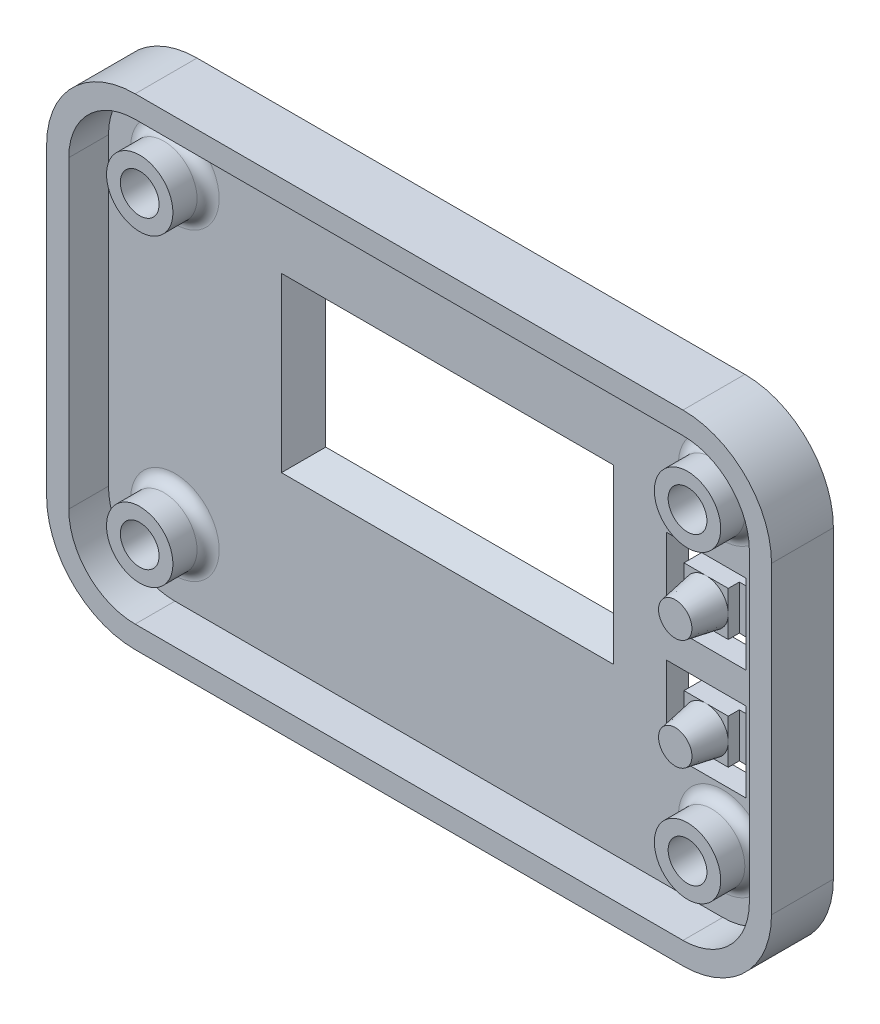
from build123d import *

# Parameters (mm, degrees)
BOSS_EXTRUDE1_DEPTH       = 3.59
SHELL1_T                  = 2
CUT_EXTRUDE2_START        = -3.59
SKETCH6_W                 = 26
SKETCH6_H                 = 11.6
CUT_EXTRUDE2_DEPTH        = 417.990251938
CUT_EXTRUDE3_REACH        = 422.58
SKETCH4_R                 = 1.75
BOSS_EXTRUDE2_START       = -0.8
SKETCH4_3_R               = 3
SKETCH4_3_R_2             = 1.75
BOSS_EXTRUDE2_DEPTH       = 4.79
BOSS_EXTRUDE3_START       = -0.41148
SKETCH4_4_R               = 3
SKETCH4_4_R_2             = 1.75
BOSS_EXTRUDE3_DEPTH       = 5.17852
CHAMFER1_SIZE             = 2
CUT_EXTRUDE4_START        = -5.59
CUT_EXTRUDE4_DEPTH        = 2
BOSS_EXTRUDE4_START       = -5.59
BOSS_EXTRUDE4_DEPTH       = 1
BOSS_EXTRUDE5_OUTLINE_R   = 1.508047724
BOSS_EXTRUDE5_DEPTH       = 2.79
BOSS_EXTRUDE5_DRAFT       = 10
BOSS_EXTRUDE5_2_OUTLINE_R = 1.508047724
BOSS_EXTRUDE5_2_DEPTH     = 2.79
BOSS_EXTRUDE5_2_DRAFT     = 10
CUT_EXTRUDE7_START        = -5.59
SKETCH4_5_R               = 3
CUT_EXTRUDE7_DEPTH        = 1.5
FILLET2_R                 = 1


# Read off the part's stored shape, not the designer's step: Boss-Extrude5
with BuildPart() as part:
    # Sketch3 → Boss-Extrude1 (new body)
    # profile 1 of 2: a face of its own
    with BuildSketch(Plane.XY):
        with BuildLine():
            Line((409.499839162, 48.499999974), (360.000160838, 48.499999974))
            ThreePointArc((360.000160838, 48.499999974), (355.756888215, 46.743111785), (354.000000026, 42.499839162))
            Line((354.000000026, 42.499839162), (354.000000026, 15.000161001))
            ThreePointArc((354.000000026, 15.000161001), (355.756887739, 10.756887739), (360.000161001, 9.000000026))
            Line((360.000161001, 9.000000026), (409.499838999, 9.000000026))
            ThreePointArc((409.499838999, 9.000000026), (413.743112261, 10.756887739), (415.499999974, 15.000161001))
            Line((415.499999974, 15.000161001), (415.499999974, 42.499839162))
            ThreePointArc((415.499999974, 42.499839162), (413.743111785, 46.743111785), (409.499839162, 48.499999974))
        make_face()
        with BuildLine():
            ThreePointArc((360, 47.5), (356.46399498, 46.03600502), (355, 42.5))
            Line((355, 42.5), (355, 15))
            ThreePointArc((355, 15), (356.463994503, 11.463994503), (360, 10))
            Line((360, 10), (409.5, 10))
            ThreePointArc((409.5, 10), (413.036005497, 11.463994503), (414.5, 15))
            Line((414.5, 15), (414.5, 42.5))
            ThreePointArc((414.5, 42.5), (413.03600502, 46.03600502), (409.5, 47.5))
            Line((409.5, 47.5), (360, 47.5))
        make_face(mode=Mode.SUBTRACT)
    # profile 2 of 2: a face of its own
    with BuildSketch(Plane.XY):
        with BuildLine():
            Line((409.5, 47.5), (360, 47.5))
            ThreePointArc((360, 47.5), (356.46399498, 46.03600502), (355, 42.5))
            Line((355, 42.5), (355, 15))
            ThreePointArc((355, 15), (356.463994503, 11.463994503), (360, 10))
            Line((360, 10), (409.5, 10))
            ThreePointArc((409.5, 10), (413.036005497, 11.463994503), (414.5, 15))
            Line((414.5, 15), (414.5, 42.5))
            ThreePointArc((414.5, 42.5), (413.03600502, 46.03600502), (409.5, 47.5))
        make_face()
    extrude(amount=-BOSS_EXTRUDE1_DEPTH)

    # Shell1
    shell1_openings = [part.faces().sort_by_distance(p)[0] for p in [
        (384.75, 28.749999938, 0),
    ]]
    offset(amount=SHELL1_T, openings=shell1_openings, kind=Kind.INTERSECTION)

    # Sketch6 → Cut-Extrude2 (cut, through all)
    with BuildSketch(Plane.XY.offset(CUT_EXTRUDE2_START)):
        with Locations((384.62991333, 31.670090703)):
            Rectangle(SKETCH6_W, SKETCH6_H)
    extrude(amount=-CUT_EXTRUDE2_DEPTH, mode=Mode.SUBTRACT)

    # Sketch4 → Cut-Extrude3 (cut, up to next)
    with BuildSketch(Plane.XY, mode=Mode.PRIVATE) as cut_extrude3_sk1:
        with Locations((409.49999888, 42.49999882)):
            Circle(SKETCH4_R)
    cut_extrude3_tool1 = extrude(cut_extrude3_sk1.sketch, amount=-CUT_EXTRUDE3_REACH, mode=Mode.PRIVATE) & part.part
    # Sketch4 → Cut-Extrude3 (cut, up to next)
    with BuildSketch(Plane.XY, mode=Mode.PRIVATE) as cut_extrude3_sk2:
        with Locations((359.99999888, 42.49999882)):
            Circle(SKETCH4_R)
    cut_extrude3_tool2 = extrude(cut_extrude3_sk2.sketch, amount=-CUT_EXTRUDE3_REACH, mode=Mode.PRIVATE) & part.part
    # Sketch4 → Cut-Extrude3 (cut, up to next)
    with BuildSketch(Plane.XY, mode=Mode.PRIVATE) as cut_extrude3_sk3:
        with Locations((359.99999888, 14.99999882)):
            Circle(SKETCH4_R)
    cut_extrude3_tool3 = extrude(cut_extrude3_sk3.sketch, amount=-CUT_EXTRUDE3_REACH, mode=Mode.PRIVATE) & part.part
    # Sketch4 → Cut-Extrude3 (cut, up to next)
    with BuildSketch(Plane.XY, mode=Mode.PRIVATE) as cut_extrude3_sk4:
        with Locations((409.49999888, 14.99999882)):
            Circle(SKETCH4_R)
    cut_extrude3_tool4 = extrude(cut_extrude3_sk4.sketch, amount=-CUT_EXTRUDE3_REACH, mode=Mode.PRIVATE) & part.part
    add(cut_extrude3_tool1.solids().sort_by_distance((409.499999, 42.499999, 0))[0], mode=Mode.SUBTRACT)
    add(cut_extrude3_tool2.solids().sort_by_distance((359.999999, 42.499999, 0))[0], mode=Mode.SUBTRACT)
    add(cut_extrude3_tool3.solids().sort_by_distance((359.999999, 14.999999, 0))[0], mode=Mode.SUBTRACT)
    add(cut_extrude3_tool4.solids().sort_by_distance((409.499999, 14.999999, 0))[0], mode=Mode.SUBTRACT)

    # Sketch4<3> → Boss-Extrude2 (add)
    # profile 1 of 4: a face of its own
    with BuildSketch(Plane.XY.offset(BOSS_EXTRUDE2_START)):
        with Locations((409.49999888, 42.49999882)):
            Circle(SKETCH4_3_R)
        with Locations((409.49999888, 42.49999882)):
            Circle(SKETCH4_3_R_2, mode=Mode.SUBTRACT)
    # profile 2 of 4: a face of its own
    with BuildSketch(Plane.XY.offset(BOSS_EXTRUDE2_START)):
        with Locations((359.99999888, 42.49999882)):
            Circle(SKETCH4_3_R)
        with Locations((359.99999888, 42.49999882)):
            Circle(SKETCH4_3_R_2, mode=Mode.SUBTRACT)
    # profile 3 of 4: a face of its own
    with BuildSketch(Plane.XY.offset(BOSS_EXTRUDE2_START)):
        with Locations((359.99999888, 14.99999882)):
            Circle(SKETCH4_3_R)
        with Locations((359.99999888, 14.99999882)):
            Circle(SKETCH4_3_R_2, mode=Mode.SUBTRACT)
    # profile 4 of 4: a face of its own
    with BuildSketch(Plane.XY.offset(BOSS_EXTRUDE2_START)):
        with Locations((409.49999888, 14.99999882)):
            Circle(SKETCH4_3_R)
        with Locations((409.49999888, 14.99999882)):
            Circle(SKETCH4_3_R_2, mode=Mode.SUBTRACT)
    extrude(amount=-BOSS_EXTRUDE2_DEPTH)

    # Sketch4<4> → Boss-Extrude3 (add)
    # profile 1 of 4: a face of its own
    with BuildSketch(Plane.XY.offset(BOSS_EXTRUDE3_START)):
        with Locations((409.49999888, 42.49999882)):
            Circle(SKETCH4_4_R)
        with Locations((409.49999888, 42.49999882)):
            Circle(SKETCH4_4_R_2, mode=Mode.SUBTRACT)
    # profile 2 of 4: a face of its own
    with BuildSketch(Plane.XY.offset(BOSS_EXTRUDE3_START)):
        with Locations((359.99999888, 42.49999882)):
            Circle(SKETCH4_4_R)
        with Locations((359.99999888, 42.49999882)):
            Circle(SKETCH4_4_R_2, mode=Mode.SUBTRACT)
    # profile 3 of 4: a face of its own
    with BuildSketch(Plane.XY.offset(BOSS_EXTRUDE3_START)):
        with Locations((359.99999888, 14.99999882)):
            Circle(SKETCH4_4_R)
        with Locations((359.99999888, 14.99999882)):
            Circle(SKETCH4_4_R_2, mode=Mode.SUBTRACT)
    # profile 4 of 4: a face of its own
    with BuildSketch(Plane.XY.offset(BOSS_EXTRUDE3_START)):
        with Locations((409.49999888, 14.99999882)):
            Circle(SKETCH4_4_R)
        with Locations((409.49999888, 14.99999882)):
            Circle(SKETCH4_4_R_2, mode=Mode.SUBTRACT)
    extrude(amount=-BOSS_EXTRUDE3_DEPTH)

    # Chamfer1
    chamfer1_edges = [part.edges().sort_by_distance(p)[0] for p in [
        (371.62991333, 31.670090703, -3.59),
        (384.62991333, 37.470090703, -3.59),
        (397.62991333, 31.670090703, -3.59),
        (384.62991333, 25.870090703, -3.59),
    ]]
    chamfer(chamfer1_edges, length=CHAMFER1_SIZE - 0.0001)  # a hair under: the kernel refuses the full size

    # Sketch8 → Cut-Extrude4 (cut)
    with BuildSketch(Plane.XY.offset(CUT_EXTRUDE4_START)):
        Polygon((404.400061047, 26.600064968), (404.400061047, 19.400064968), (411.600061047, 19.400064968), (411.600061047, 21.000064968), (410.000061047, 21.000064968), (408.000061047, 21.000064968), (406.000061047, 21.000064968), (406.000061047, 23.000064968), (406.000061047, 25.000064968), (408.000061047, 25.000064968), (410.000061047, 25.000064968), (411.600061047, 25.000064968), (411.600061047, 26.600064968), align=None)
        Polygon((406.000061047, 33.000064968), (406.000061047, 35.000064968), (408.000061047, 35.000064968), (410.000061047, 35.000064968), (411.600061047, 35.000064968), (411.600061047, 36.600064968), (404.400061047, 36.600064968), (404.400061047, 29.400064968), (411.600061047, 29.400064968), (411.600061047, 31.000064968), (410.000061047, 31.000064968), (408.000061047, 31.000064968), (406.000061047, 31.000064968), align=None)
        Polygon((411.600061047, 35.000064968), (410.000061047, 35.000064968), (410.000061047, 33.000064968), (410.000061047, 31.000064968), (411.600061047, 31.000064968), align=None)
        Polygon((410.000061047, 21.000064968), (411.600061047, 21.000064968), (411.600061047, 25.000064968), (410.000061047, 25.000064968), (410.000061047, 23.000064968), align=None)
    extrude(amount=CUT_EXTRUDE4_DEPTH, mode=Mode.SUBTRACT)


with BuildPart() as cut_extrude4_piece_1:
    # of the separate pieces the step leaves, piece 1, a body of its own (cut_extrude4_pieces)
    add(part.part.solids().sort_by_distance((409.499839162, 48.499999974, -3.59))[0])



with BuildPart() as cut_extrude4_piece_2:
    # of the separate pieces the step leaves, piece 2, a body of its own (cut_extrude4_pieces)
    add(part.part.solids().sort_by_distance((410.000061047, 35.000064968, -3.59))[0])


with BuildPart() as cut_extrude4_piece_3:
    # of the separate pieces the step leaves, piece 3, a body of its own (cut_extrude4_pieces)
    add(part.part.solids().sort_by_distance((406.000061047, 25.000064968, -3.59))[0])


with BuildPart() as cut_extrude4_piece_1_1:
    add(cut_extrude4_piece_1.part)

    add(cut_extrude4_piece_2.part)  # Boss-Extrude4 merges Cut-Extrude4 piece 2

    add(cut_extrude4_piece_3.part)  # Boss-Extrude4 merges Cut-Extrude4 piece 3
    # Sketch8<3> → Boss-Extrude4 (add)
    with BuildSketch(Plane.XY.offset(BOSS_EXTRUDE4_START)):
        Polygon((411.600061047, 35.000064968), (410.000061047, 35.000064968), (410.000061047, 33.000064968), (410.000061047, 31.000064968), (411.600061047, 31.000064968), align=None)
        Polygon((410.000061047, 21.000064968), (411.600061047, 21.000064968), (411.600061047, 25.000064968), (410.000061047, 25.000064968), (410.000061047, 23.000064968), align=None)
    extrude(amount=BOSS_EXTRUDE4_DEPTH)


with BuildPart() as boss_extrude5_tool:
    # Boss-Extrude5 outline → Boss-Extrude5 (with draft: the straight prism first)
    with BuildSketch(Plane.XY.offset(-0.8)):
        with Locations((408.000061047, 33.000064968)):
            Circle(BOSS_EXTRUDE5_OUTLINE_R)
    extrude(amount=-BOSS_EXTRUDE5_DEPTH)
    # Boss-Extrude5: the draft: its side faces are tilted about the plane it starts from
    boss_extrude5_sides = [boss_extrude5_tool.faces().sort_by_distance(p)[0] for p in [
        (406.492013323, 33.000064968, -2.195),
    ]]
    draft(boss_extrude5_sides, Plane.XY.offset(-0.8), BOSS_EXTRUDE5_DRAFT)


with BuildPart() as cut_extrude4_piece_1_2:
    add(cut_extrude4_piece_1_1.part)

    # Boss-Extrude5: add boss_extrude5_tool
    add(boss_extrude5_tool.part)


with BuildPart() as boss_extrude5_2_tool:
    # Boss-Extrude5 2 outline → Boss-Extrude5 2 (with draft: the straight prism first)
    with BuildSketch(Plane.XY.offset(-0.8)):
        with Locations((408.000061047, 23.000064968)):
            Circle(BOSS_EXTRUDE5_2_OUTLINE_R)
    extrude(amount=-BOSS_EXTRUDE5_2_DEPTH)
    # Boss-Extrude5 2: the draft: its side faces are tilted about the plane it starts from
    boss_extrude5_2_sides = [boss_extrude5_2_tool.faces().sort_by_distance(p)[0] for p in [
        (406.492013323, 23.000064968, -2.195),
    ]]
    draft(boss_extrude5_2_sides, Plane.XY.offset(-0.8), BOSS_EXTRUDE5_2_DRAFT)


with BuildPart() as cut_extrude4_piece_1_3:
    add(cut_extrude4_piece_1_2.part)

    # Boss-Extrude5 2: add boss_extrude5_2_tool
    add(boss_extrude5_2_tool.part)

    # Sketch4<5> → Cut-Extrude7 (cut)
    with BuildSketch(Plane.XY.offset(CUT_EXTRUDE7_START)):
        with Locations((409.49999888, 42.49999882)):
            Circle(SKETCH4_5_R)
        with Locations((359.99999888, 42.49999882)):
            Circle(SKETCH4_5_R)
        with Locations((359.99999888, 14.99999882)):
            Circle(SKETCH4_5_R)
        with Locations((409.49999888, 14.99999882)):
            Circle(SKETCH4_5_R)
    extrude(amount=CUT_EXTRUDE7_DEPTH, mode=Mode.SUBTRACT)

    # Fillet2
    fillet2_edges = [cut_extrude4_piece_1_3.edges().sort_by_distance(p)[0] for p in [
        (356.99999888, 14.99999882, -3.59),
        (406.49999888, 42.49999882, -3.59),
        (356.99999888, 42.49999882, -3.59),
        (406.49999888, 14.99999882, -3.59),
    ]]
    fillet(fillet2_edges, radius=FILLET2_R)


solid = cut_extrude4_piece_1_3.part
